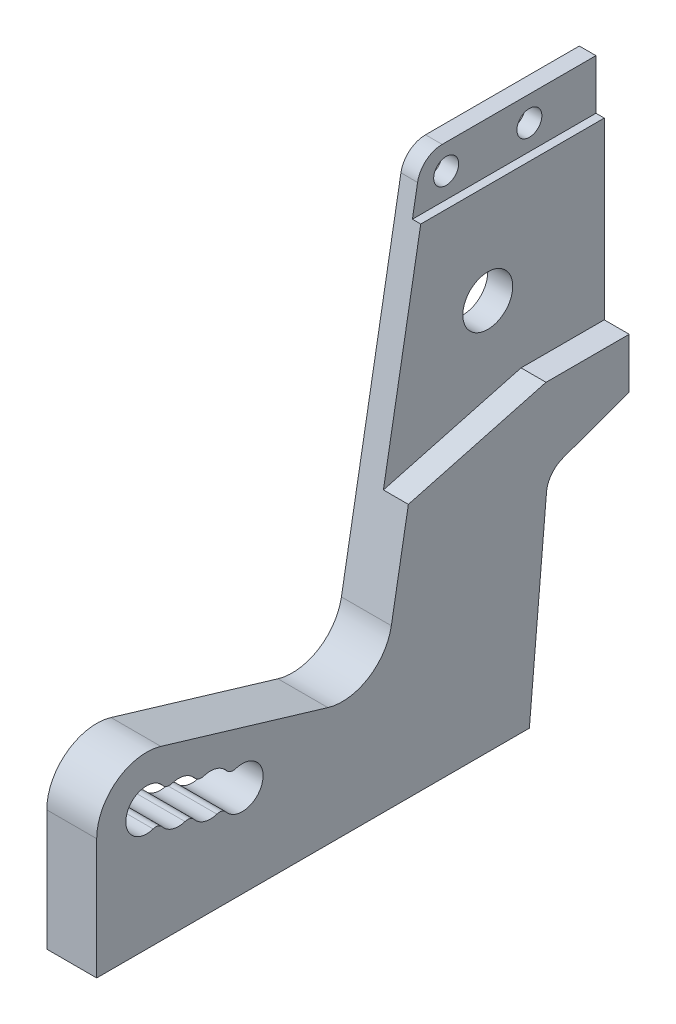
from build123d import *

# Parameters (mm, degrees)
SKETCH1_W                   = 64
SKETCH1_H                   = 62
SKETCH1_R                   = 2.5
SKETCH1_R_2                 = 3
BOSS_EXTRUDE1_DEPTH         = 6
CUT_EXTRUDE2_REACH          = 91.308
FILLET2_R                   = 3
TAP_DRILL_FOR_M3_TAP1_D     = 2.5
TAP_DRILL_FOR_M3_TAP1_DEPTH = 9
TAP_DRILL_FOR_M3_TAP1_TIP   = 0.751075774
CUT_EXTRUDE3_DEPTH          = 8
CUT_EXTRUDE4_DEPTH          = 3
FILLET3_R                   = 3
CUT_EXTRUDE5_REACH          = 91.157
SKETCH14_R                  = 1.5
CUT_EXTRUDE6_REACH          = 91.308
SKETCH15_R                  = 2.5
LPATTERN3_COUNT             = 3
LPATTERN3_PITCH             = 4
FILLET4_R                   = 1
SKETCH16_W                  = 22.057961884
SKETCH16_H                  = 6
CUT_EXTRUDE7_DEPTH          = 1


with BuildPart() as part:
    # Sketch1 → Boss-Extrude1 (new body)
    with BuildSketch(Plane(origin=(0, 0, 0), x_dir=(0, 0, -1), z_dir=(1, 0, 0))):
        with Locations((32, 31)):
            Rectangle(SKETCH1_W, SKETCH1_H)
        with Locations((6, 14.5)):
            Circle(SKETCH1_R, mode=Mode.SUBTRACT)
        with Locations((50, 44)):
            Circle(SKETCH1_R_2, mode=Mode.SUBTRACT)
    extrude(amount=BOSS_EXTRUDE1_DEPTH)

    # Sketch3 → Cut-Extrude2 (cut, up to next)
    with BuildSketch(Plane(origin=(6, 0, 0), x_dir=(0, 0, -1), z_dir=(1, 0, 0)), mode=Mode.PRIVATE) as cut_extrude2_sk1:
        Polygon((64, 0), (52, 0), (54.225932994, 25.442530542), (64, 29), align=None)
    cut_extrude2_tool1 = extrude(cut_extrude2_sk1.sketch, amount=-CUT_EXTRUDE2_REACH, mode=Mode.PRIVATE) & part.part
    add(cut_extrude2_tool1.solids().sort_by_distance((6, 13.1347, -58.667711))[0], mode=Mode.SUBTRACT)

    # Fillet2
    fillet2_edges = [part.edges().sort_by_distance(p)[0] for p in [
        (3, 25.442530542, -54.225932994),
    ]]
    fillet(fillet2_edges, radius=FILLET2_R)

    # Tap Drill for M3 Tap1
    with Locations(Plane(origin=(0, 0, 0), x_dir=(-1, 0, 0), z_dir=(0, -1, 0))):
        with Locations((-3, 46), (-3, 10)):
            Hole(TAP_DRILL_FOR_M3_TAP1_D / 2, depth=TAP_DRILL_FOR_M3_TAP1_DEPTH)
            with Locations((0, 0, -(TAP_DRILL_FOR_M3_TAP1_DEPTH + TAP_DRILL_FOR_M3_TAP1_TIP / 2))):  # 118° drill point
                Cone(0, TAP_DRILL_FOR_M3_TAP1_D / 2, TAP_DRILL_FOR_M3_TAP1_TIP, mode=Mode.SUBTRACT)

    # Sketch9 → Cut-Extrude3 (cut)
    with BuildSketch(Plane(origin=(6, 0, 0), x_dir=(0, 0, -1), z_dir=(1, 0, 0))):
        with BuildLine():
            Line((7.718264205, 20.248701429), (27.783442934, 14.251298571))
            ThreePointArc((27.783442934, 14.251298571), (32.652701535, 14.894000165), (35.410553657, 18.958110934))
            Line((35.410553657, 18.958110934), (43, 62))
            Line((43, 62), (0, 62))
            Line((0, 62), (0, 14.5))
            ThreePointArc((0, 14.5), (2.415978881, 19.311942707), (7.718264205, 20.248701429))
        make_face()
    extrude(amount=-CUT_EXTRUDE3_DEPTH, mode=Mode.SUBTRACT)

    # Sketch13 → Cut-Extrude4 (cut)
    with BuildSketch(Plane(origin=(6, 0, 0), x_dir=(0, 0, -1), z_dir=(1, 0, 0))):
        Polygon((54, 35), (64, 35), (64, 62), (43, 62), (37.457598082, 30.567476765), align=None)
    extrude(amount=-CUT_EXTRUDE4_DEPTH, mode=Mode.SUBTRACT)

    # Fillet3
    fillet3_edges = [part.edges().sort_by_distance(p)[0] for p in [
        (1.5, 62, -43),
    ]]
    fillet(fillet3_edges, radius=FILLET3_R)

    # Sketch14 → Cut-Extrude5 (cut, up to next)
    with BuildSketch(Plane(origin=(3, 0, 0), x_dir=(0, 0, -1), z_dir=(1, 0, 0)), mode=Mode.PRIVATE) as cut_extrude5_sk1:
        with Locations((56, 59)):
            Circle(SKETCH14_R)
    cut_extrude5_tool1 = extrude(cut_extrude5_sk1.sketch, amount=-CUT_EXTRUDE5_REACH, mode=Mode.PRIVATE) & part.part
    # Sketch14 → Cut-Extrude5 (cut, up to next)
    with BuildSketch(Plane(origin=(3, 0, 0), x_dir=(0, 0, -1), z_dir=(1, 0, 0)), mode=Mode.PRIVATE) as cut_extrude5_sk2:
        with Locations((46, 59)):
            Circle(SKETCH14_R)
    cut_extrude5_tool2 = extrude(cut_extrude5_sk2.sketch, amount=-CUT_EXTRUDE5_REACH, mode=Mode.PRIVATE) & part.part
    add(cut_extrude5_tool1.solids().sort_by_distance((3, 59, -56))[0], mode=Mode.SUBTRACT)
    add(cut_extrude5_tool2.solids().sort_by_distance((3, 59, -46))[0], mode=Mode.SUBTRACT)

    # Sketch15 → Cut-Extrude6 (cut, up to next)
    with BuildSketch(Plane.ZY, mode=Mode.PRIVATE) as cut_extrude6_sk1:
        with Locations((-9.832467619, 13.35449053)):
            Circle(SKETCH15_R)
    cut_extrude6_tool1 = extrude(cut_extrude6_sk1.sketch, amount=-CUT_EXTRUDE6_REACH, mode=Mode.PRIVATE) & part.part
    cut_extrude6 = cut_extrude6_tool1.solids().sort_by_distance((0, 13.354491, -9.832468))[0]
    add(cut_extrude6, mode=Mode.SUBTRACT)

    # LPattern3: Cut-Extrude6 ×3
    with Locations(*[Vector(0, -0.28637736754813403, -0.9581169048483599) * (i * LPATTERN3_PITCH) for i in range(1, LPATTERN3_COUNT)]):
        add(cut_extrude6, mode=Mode.SUBTRACT)

    # Fillet4
    fillet4_edges = [part.edges().sort_by_distance(p)[0] for p in [
        (3, 12.490069908, -7.486667758),
        (3, 11.344560437, -11.319135378),
        (3, 10.199050967, -15.151602997),
        (3, 13.073401682, -16.0107351),
        (3, 14.218911152, -12.17826748),
        (3, 15.364420622, -8.345799861),
    ]]
    fillet(fillet4_edges, radius=FILLET4_R)

    # Sketch16 → Cut-Extrude7 (cut)
    with BuildSketch(Plane(origin=(3, 0, 0), x_dir=(0, 0, -1), z_dir=(1, 0, 0))):
        with Locations((52.971019058, 59)):
            Rectangle(SKETCH16_W, SKETCH16_H)
    extrude(amount=-CUT_EXTRUDE7_DEPTH, mode=Mode.SUBTRACT)


solid = part.part
